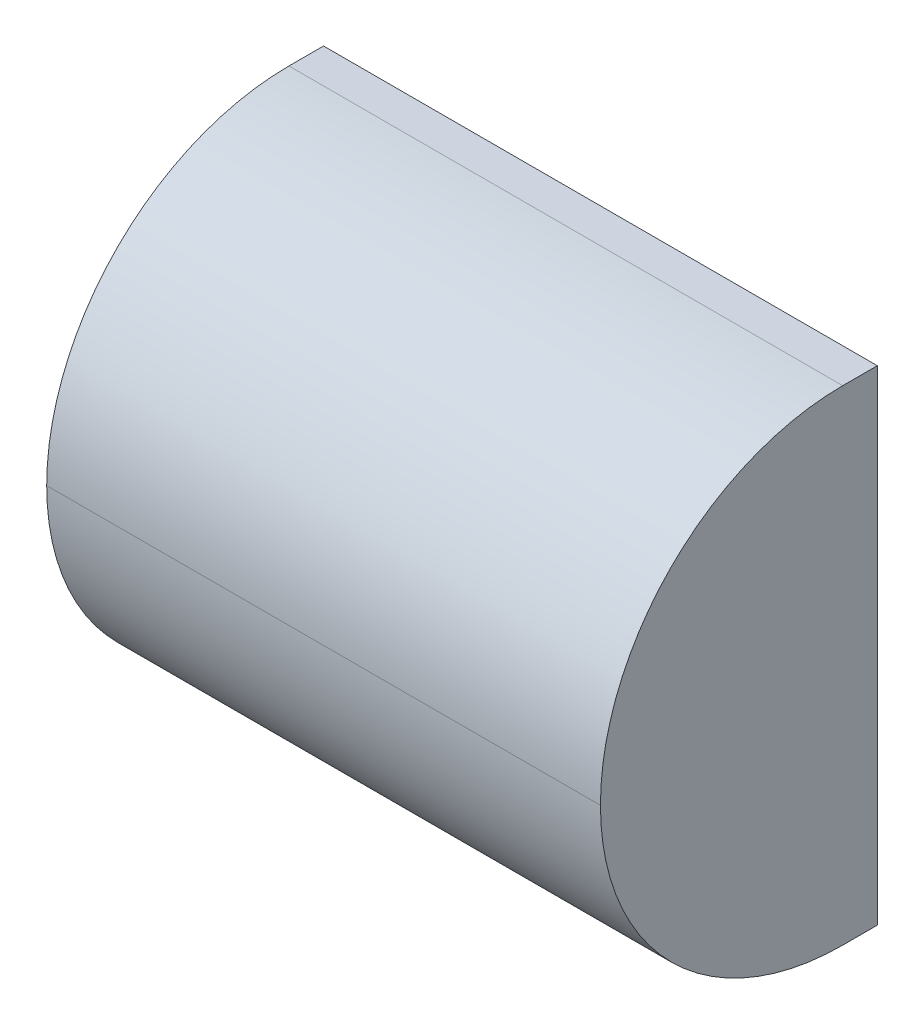
from build123d import *

# Parameters (mm, degrees)
SKETCH1_W           = 8
SKETCH1_H           = 7
BOSS_EXTRUDE1_DEPTH = 4
FILLET1_R           = 3.5


with BuildPart() as part:
    # Sketch1 → Boss-Extrude1 (new body)
    with BuildSketch(Plane.XY):
        with Locations((4, 3.5)):
            Rectangle(SKETCH1_W, SKETCH1_H)
    extrude(amount=BOSS_EXTRUDE1_DEPTH)

    # Fillet1
    fillet1_edges = [part.edges().sort_by_distance(p)[0] for p in [
        (4, 0, 4),
        (4, 7, 4),
    ]]
    fillet(fillet1_edges, radius=FILLET1_R - 0.0001)  # a hair under: the kernel refuses the full size


solid = part.part
